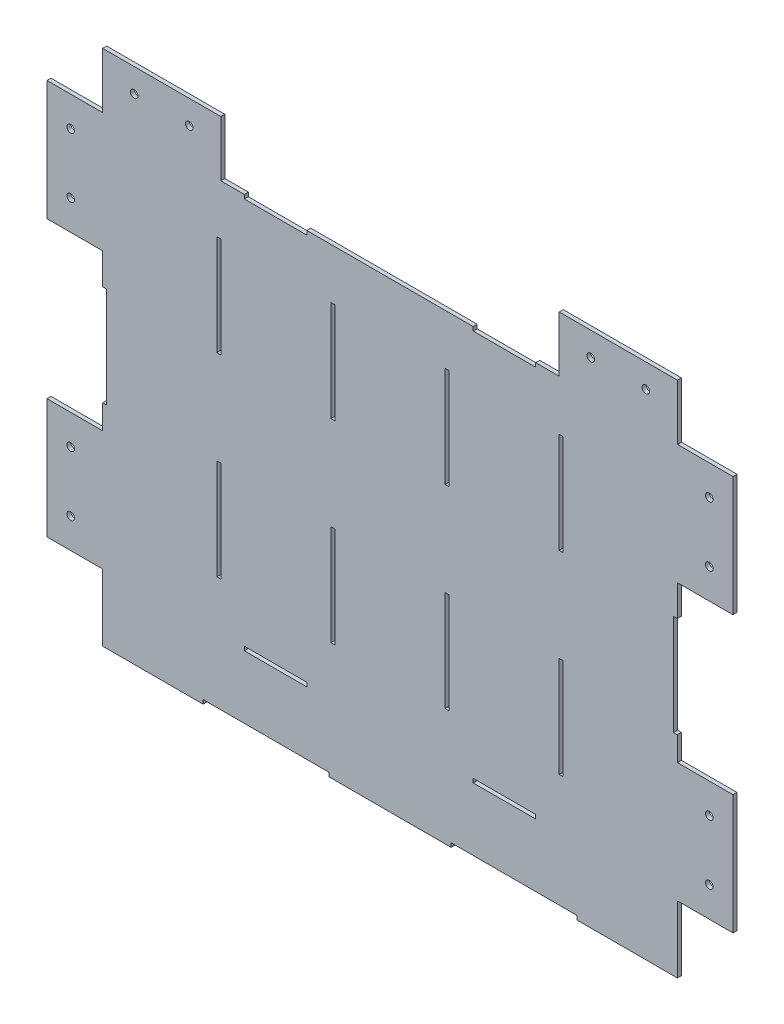
from build123d import *

# Parameters (mm, degrees)
SKETCH1_W                 = 457.223
SKETCH1_H                 = 367.60800004
BOSS_EXTRUDE2_DEPTH       = 3.175
SKETCH4_W                 = 3.175
SKETCH4_H                 = 80
CUT_EXTRUDE1_DEPTH        = 3.175
LPATTERN1_COPY_1_SKETCH_W = 3.175
LPATTERN1_COPY_1_SKETCH_H = 80
LPATTERN1_COPY_1_DEPTH    = 3.175
LPATTERN1_COPY_2_SKETCH_W = 3.175
LPATTERN1_COPY_2_SKETCH_H = 80
LPATTERN1_COPY_2_DEPTH    = 3.175
LPATTERN1_COPY_3_SKETCH_W = 3.175
LPATTERN1_COPY_3_SKETCH_H = 80
LPATTERN1_COPY_3_DEPTH    = 3.175
LPATTERN1_COPY_4_SKETCH_W = 3.175
LPATTERN1_COPY_4_SKETCH_H = 80
LPATTERN1_COPY_4_DEPTH    = 3.175
LPATTERN1_COPY_5_SKETCH_W = 3.175
LPATTERN1_COPY_5_SKETCH_H = 80
LPATTERN1_COPY_5_DEPTH    = 3.175
LPATTERN1_COPY_6_SKETCH_W = 3.175
LPATTERN1_COPY_6_SKETCH_H = 80
LPATTERN1_COPY_6_DEPTH    = 3.175
SKETCH5_W                 = 49.658811606
SKETCH5_H                 = 3.175
CUT_EXTRUDE2_DEPTH        = 3.175
MIRROR3_COPY_1_SKETCH_W   = 49.658811606
MIRROR3_COPY_1_SKETCH_H   = 3.175
MIRROR3_COPY_1_DEPTH      = 3.175
MIRROR3_COPY_2_SKETCH_W   = 49.658811606
MIRROR3_COPY_2_SKETCH_H   = 3.175
MIRROR3_COPY_2_DEPTH      = 3.175
SKETCH6_W                 = 3.175
SKETCH6_H                 = 80
CUT_EXTRUDE3_DEPTH        = 311.705796904
SKETCH7_W                 = 100
SKETCH7_H                 = 3.175
CUT_EXTRUDE4_DEPTH        = 3.175
SKETCH8_W                 = 44.275
SKETCH8_H                 = 95.25
SKETCH8_R                 = 3
SKETCH8_W_2               = 93.98
SKETCH8_H_2               = 44.275
BOSS_EXTRUDE3_DEPTH       = 3.175


with BuildPart() as part:
    # Sketch1 → Boss-Extrude2 (new body)
    with BuildSketch(Plane.XY):
        with Locations((0, -26.588)):
            Rectangle(SKETCH1_W, SKETCH1_H)
    extrude(amount=BOSS_EXTRUDE2_DEPTH)

    # Sketch4 → Cut-Extrude1 (cut)
    with BuildSketch(Plane.XY.offset(3.175)):
        with Locations((-136.213, 77.21600002)):
            Rectangle(SKETCH4_W, SKETCH4_H)
    cut_extrude1 = extrude(amount=-CUT_EXTRUDE1_DEPTH, mode=Mode.SUBTRACT)

    # Mirror1: Cut-Extrude1 across plane
    add(cut_extrude1.mirror(Plane.ZX), mode=Mode.SUBTRACT)

    # LPattern1 copy 1 sketch → LPattern1 copy 1 (cut)
    with BuildSketch(Plane(origin=(90.807, 0, 3.175), x_dir=(1, 0, 0), z_dir=(0, 0, 1))):
        with Locations((-136.213, -77.21600002)):
            Rectangle(LPATTERN1_COPY_1_SKETCH_W, LPATTERN1_COPY_1_SKETCH_H)
    extrude(amount=-LPATTERN1_COPY_1_DEPTH, mode=Mode.SUBTRACT)

    # LPattern1 copy 2 sketch → LPattern1 copy 2 (cut)
    with BuildSketch(Plane(origin=(181.614, 0, 3.175), x_dir=(1, 0, 0), z_dir=(0, 0, 1))):
        with Locations((-136.213, -77.21600002)):
            Rectangle(LPATTERN1_COPY_2_SKETCH_W, LPATTERN1_COPY_2_SKETCH_H)
    extrude(amount=-LPATTERN1_COPY_2_DEPTH, mode=Mode.SUBTRACT)

    # LPattern1 copy 3 sketch → LPattern1 copy 3 (cut)
    with BuildSketch(Plane(origin=(272.421, 0, 3.175), x_dir=(1, 0, 0), z_dir=(0, 0, 1))):
        with Locations((-136.213, -77.21600002)):
            Rectangle(LPATTERN1_COPY_3_SKETCH_W, LPATTERN1_COPY_3_SKETCH_H)
    extrude(amount=-LPATTERN1_COPY_3_DEPTH, mode=Mode.SUBTRACT)

    # LPattern1 copy 4 sketch → LPattern1 copy 4 (cut)
    with BuildSketch(Plane(origin=(90.807, 0, 3.175), x_dir=(1, 0, 0), z_dir=(0, 0, 1))):
        with Locations((-136.213, 77.21600002)):
            Rectangle(LPATTERN1_COPY_4_SKETCH_W, LPATTERN1_COPY_4_SKETCH_H)
    extrude(amount=-LPATTERN1_COPY_4_DEPTH, mode=Mode.SUBTRACT)

    # LPattern1 copy 5 sketch → LPattern1 copy 5 (cut)
    with BuildSketch(Plane(origin=(181.614, 0, 3.175), x_dir=(1, 0, 0), z_dir=(0, 0, 1))):
        with Locations((-136.213, 77.21600002)):
            Rectangle(LPATTERN1_COPY_5_SKETCH_W, LPATTERN1_COPY_5_SKETCH_H)
    extrude(amount=-LPATTERN1_COPY_5_DEPTH, mode=Mode.SUBTRACT)

    # LPattern1 copy 6 sketch → LPattern1 copy 6 (cut)
    with BuildSketch(Plane(origin=(272.421, 0, 3.175), x_dir=(1, 0, 0), z_dir=(0, 0, 1))):
        with Locations((-136.213, 77.21600002)):
            Rectangle(LPATTERN1_COPY_6_SKETCH_W, LPATTERN1_COPY_6_SKETCH_H)
    extrude(amount=-LPATTERN1_COPY_6_DEPTH, mode=Mode.SUBTRACT)

    # Sketch5 → Cut-Extrude2 (cut)
    with BuildSketch(Plane.XY.offset(3.175)):
        with Locations((-91.020094169, -155.62850002)):
            Rectangle(SKETCH5_W, SKETCH5_H)
    cut_extrude2 = extrude(amount=-CUT_EXTRUDE2_DEPTH, mode=Mode.SUBTRACT)

    # Mirror2: Cut-Extrude2 across plane
    add(cut_extrude2.mirror(Plane(origin=(0, 0, 0), x_dir=(0, 0, 1), z_dir=(1, 0, 0))), mode=Mode.SUBTRACT)

    # Mirror3 copy 1 sketch → Mirror3 copy 1 (cut)
    with BuildSketch(Plane(origin=(0, 0, 3.175), x_dir=(-1, 0, 0), z_dir=(0, 0, 1))):
        with Locations((-91.020094169, -155.62850002)):
            Rectangle(MIRROR3_COPY_1_SKETCH_W, MIRROR3_COPY_1_SKETCH_H)
    extrude(amount=-MIRROR3_COPY_1_DEPTH, mode=Mode.SUBTRACT)

    # Mirror3 copy 2 sketch → Mirror3 copy 2 (cut)
    with BuildSketch(Plane.XY.offset(3.175)):
        with Locations((-91.020094169, 155.62850002)):
            Rectangle(MIRROR3_COPY_2_SKETCH_W, MIRROR3_COPY_2_SKETCH_H)
    extrude(amount=-MIRROR3_COPY_2_DEPTH, mode=Mode.SUBTRACT)

    # Sketch6 → Cut-Extrude3 (cut, through all)
    with BuildSketch(Plane.XY.offset(3.175)):
        with Locations((-227.024, -2.78399998)):
            Rectangle(SKETCH6_W, SKETCH6_H)
    cut_extrude3 = extrude(amount=-CUT_EXTRUDE3_DEPTH, mode=Mode.SUBTRACT)

    # Mirror5: Cut-Extrude3 across plane
    add(cut_extrude3.mirror(Plane(origin=(0, 0, 0), x_dir=(0, 0, 1), z_dir=(1, 0, 0))), mode=Mode.SUBTRACT)

    # Sketch7 → Cut-Extrude4 (cut)
    with BuildSketch(Plane.XY.offset(3.175)):
        with Locations((-98.6115, -208.8045)):
            Rectangle(SKETCH7_W, SKETCH7_H)
    cut_extrude4 = extrude(amount=-CUT_EXTRUDE4_DEPTH, mode=Mode.SUBTRACT)

    # Mirror6: Cut-Extrude4 across plane
    add(cut_extrude4.mirror(Plane(origin=(0, 0, 0), x_dir=(0, 0, 1), z_dir=(1, 0, 0))), mode=Mode.SUBTRACT)

    # Sketch8 → Boss-Extrude3 (add)
    # profile 1 of 3: a face of its own
    with BuildSketch(Plane(origin=(0, 0, 0), x_dir=(-1, 0, 0), z_dir=(0, 0, -1))):
        with Locations((-250.749, 109.59100002)):
            Rectangle(SKETCH8_W, SKETCH8_H)
        with Locations((-254.0115, 85.77850002)):
            Circle(SKETCH8_R, mode=Mode.SUBTRACT)
        with Locations((-254.0115, 133.40350002)):
            Circle(SKETCH8_R, mode=Mode.SUBTRACT)
    # profile 2 of 3: a face of its own
    with BuildSketch(Plane(origin=(0, 0, 0), x_dir=(-1, 0, 0), z_dir=(0, 0, -1))):
        with Locations((-181.6215, 179.35350002)):
            Rectangle(SKETCH8_W_2, SKETCH8_H_2)
        with Locations((-203.529, 182.61600002)):
            Circle(SKETCH8_R, mode=Mode.SUBTRACT)
        with Locations((-159.714, 182.61600002)):
            Circle(SKETCH8_R, mode=Mode.SUBTRACT)
    # profile 3 of 3: a face of its own
    with BuildSketch(Plane(origin=(0, 0, 0), x_dir=(-1, 0, 0), z_dir=(0, 0, -1))):
        with Locations((-250.749, -109.620240426)):
            Rectangle(SKETCH8_W, SKETCH8_H)
        with Locations((-254.0115, -133.432740426)):
            Circle(SKETCH8_R, mode=Mode.SUBTRACT)
        with Locations((-254.0115, -85.807740426)):
            Circle(SKETCH8_R, mode=Mode.SUBTRACT)
    boss_extrude3 = extrude(amount=-BOSS_EXTRUDE3_DEPTH)

    # Mirror7: Boss-Extrude3 across plane
    add(boss_extrude3.mirror(Plane(origin=(0, 0, 0), x_dir=(0, 0, 1), z_dir=(1, 0, 0))))


solid = part.part
